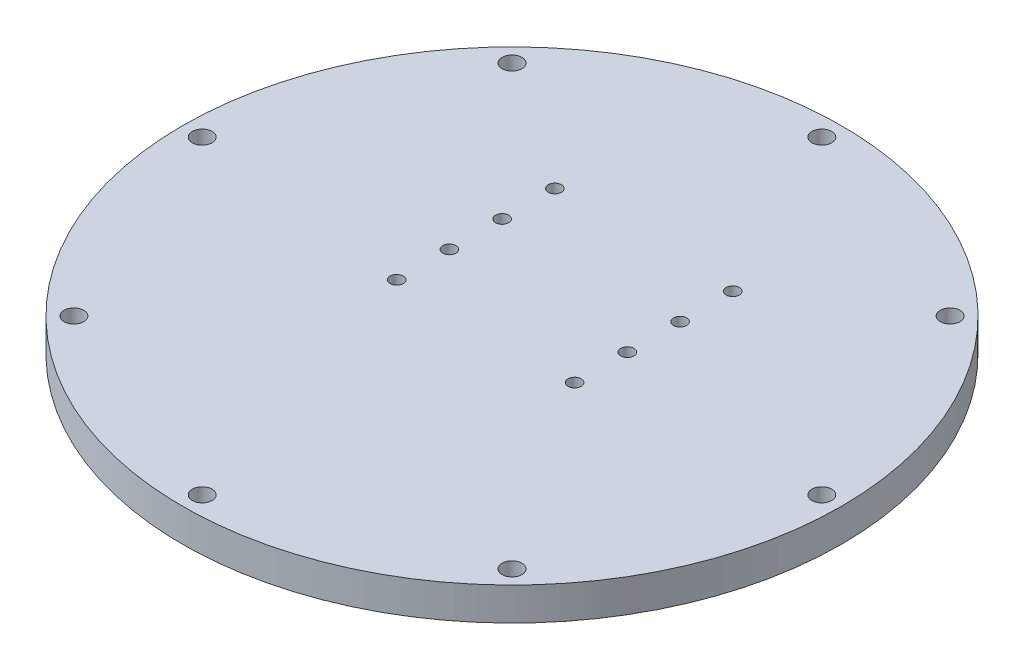
from build123d import *

# Parameters (mm, degrees)
SKETCH3_R          = 1
SKETCH3_R_2        = 1.5
CUT_EXTRUDE1_DEPTH = 71.887234394
SKETCH5_R          = 3
CUT_EXTRUDE2_DEPTH = 2


with BuildPart() as part:
    # Sketch2 → Revolve1 (revolve)
    with BuildSketch(Plane.XY):
        Polygon((0, 5), (0, 0), (50, 0), (50, 5), (41, 5), (38, 5), align=None)
    revolve(axis=Axis((0, 0, 0), (0, 1, 0)))

    # Sketch3 → Cut-Extrude1 (cut, through all)
    with BuildSketch(Plane(origin=(0, 0, 0), x_dir=(1, 0, 0), z_dir=(0, 1, 0))):
        with Locations((-13.5, 12)):
            Circle(SKETCH3_R)
        with Locations((13.5, 12)):
            Circle(SKETCH3_R)
        with Locations((-13.5, 4)):
            Circle(SKETCH3_R)
        with Locations((-13.5, -4)):
            Circle(SKETCH3_R)
        with Locations((13.5, 4)):
            Circle(SKETCH3_R)
        with Locations((13.5, -4)):
            Circle(SKETCH3_R)
        with Locations((-13.5, 20)):
            Circle(SKETCH3_R)
        with Locations((13.5, 20)):
            Circle(SKETCH3_R)
        with Locations((0, -47)):
            Circle(SKETCH3_R_2)
        with Locations((-33.234018716, -33.234018716)):
            Circle(SKETCH3_R_2)
        with Locations((-47, 0)):
            Circle(SKETCH3_R_2)
        with Locations((-33.234018716, 33.234018716)):
            Circle(SKETCH3_R_2)
        with Locations((0, 47)):
            Circle(SKETCH3_R_2)
        with Locations((33.234018716, 33.234018716)):
            Circle(SKETCH3_R_2)
        with Locations((47, 0)):
            Circle(SKETCH3_R_2)
        with Locations((33.234018716, -33.234018716)):
            Circle(SKETCH3_R_2)
    extrude(amount=CUT_EXTRUDE1_DEPTH, mode=Mode.SUBTRACT)

    # Sketch5 → Cut-Extrude2 (cut)
    with BuildSketch(Plane(origin=(0, 0, 0), x_dir=(-1, 0, 0), z_dir=(0, -1, 0))):
        with Locations((13.5, -4)):
            Circle(SKETCH5_R)
        with Locations((13.5, 4)):
            Circle(SKETCH5_R)
        with Locations((13.5, 12)):
            Circle(SKETCH5_R)
        with Locations((13.5, 20)):
            Circle(SKETCH5_R)
        with Locations((-13.5, -4)):
            Circle(SKETCH5_R)
        with Locations((-13.5, 4)):
            Circle(SKETCH5_R)
        with Locations((-13.5, 12)):
            Circle(SKETCH5_R)
        with Locations((-13.5, 20)):
            Circle(SKETCH5_R)
    extrude(amount=-CUT_EXTRUDE2_DEPTH, mode=Mode.SUBTRACT)


solid = part.part
